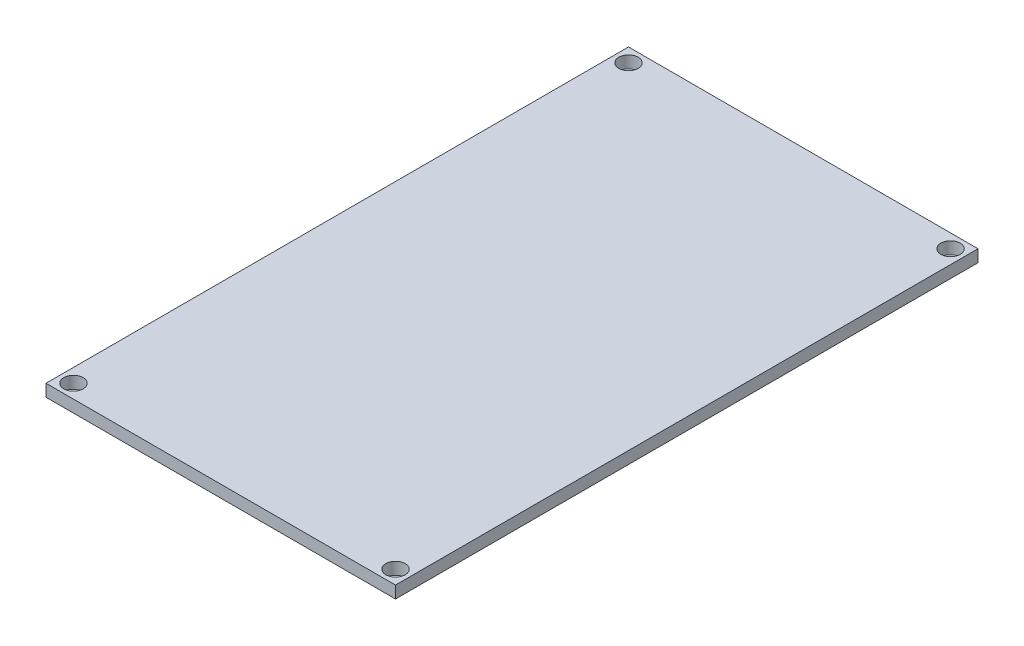
from build123d import *

# Parameters (mm, degrees)
SKETCH3_R           = 1
BOSS_EXTRUDE1_DEPTH = 1.25


with BuildPart() as part:
    # Sketch3 → Boss-Extrude1 (new body)
    with BuildSketch(Plane(origin=(0, 0, 0), x_dir=(1, 0, 0), z_dir=(0, 1, 0))):
        Polygon((-18, 35.809268437), (-18, 26), (-18, -14.381463126), (-18, -24.190731563), (-8.190731563, -24.190731563), (8.190731563, -24.190731563), (18, -24.190731563), (18, -14.381463126), (18, 26), (18, 35.809268437), (8.190731563, 35.809268437), (-8.190731563, 35.809268437), align=None)
        with Locations((-16.585786438, -22.776518001)):
            Circle(SKETCH3_R, mode=Mode.SUBTRACT)
        with Locations((16.585786438, -22.776518001)):
            Circle(SKETCH3_R, mode=Mode.SUBTRACT)
        with Locations((-16.585786438, 34.395054875)):
            Circle(SKETCH3_R, mode=Mode.SUBTRACT)
        with Locations((16.585786438, 34.395054875)):
            Circle(SKETCH3_R, mode=Mode.SUBTRACT)
    extrude(amount=BOSS_EXTRUDE1_DEPTH)


solid = part.part
